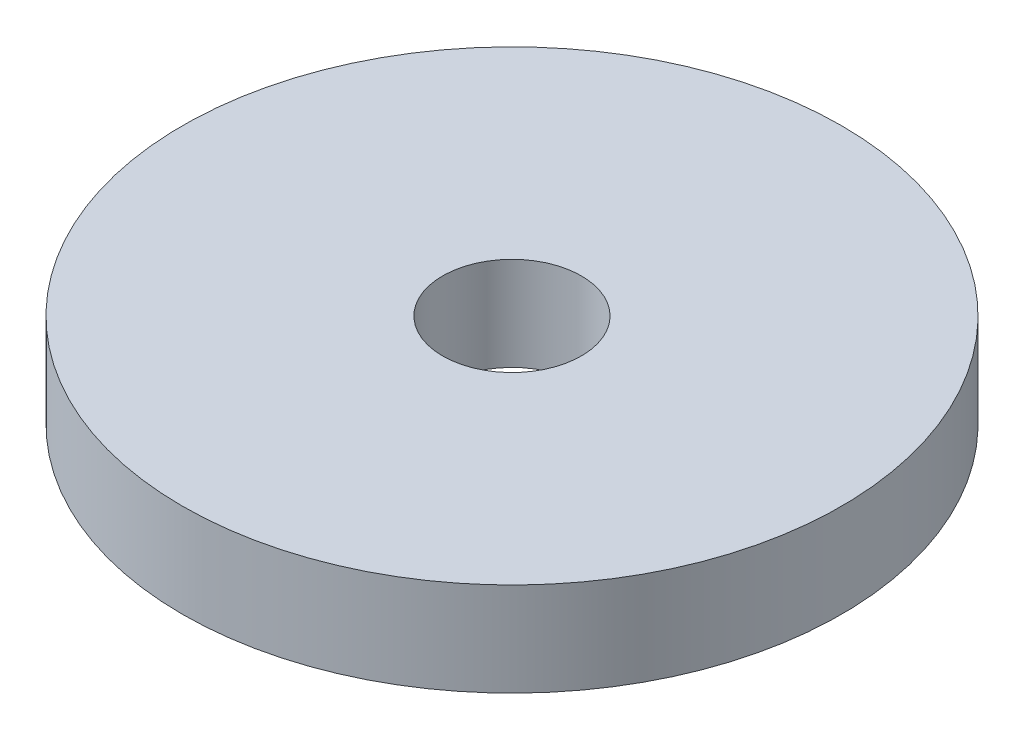
from build123d import *

# Parameters (mm, degrees)
SKETCH1_R           = 95
BOSS_EXTRUDE1_DEPTH = 27
SKETCH2_R           = 20
CUT_EXTRUDE1_DEPTH  = 138.03649149


with BuildPart() as part:
    # Sketch1 → Boss-Extrude1 (new body)
    with BuildSketch(Plane(origin=(0, 0, 0), x_dir=(1, 0, 0), z_dir=(0, 1, 0))):
        Circle(SKETCH1_R)
    extrude(amount=BOSS_EXTRUDE1_DEPTH)

    # Sketch2 → Cut-Extrude1 (cut, through all)
    with BuildSketch(Plane(origin=(0, 0, 0), x_dir=(1, 0, 0), z_dir=(0, 1, 0))):
        Circle(SKETCH2_R)
    extrude(amount=CUT_EXTRUDE1_DEPTH, mode=Mode.SUBTRACT)


solid = part.part
